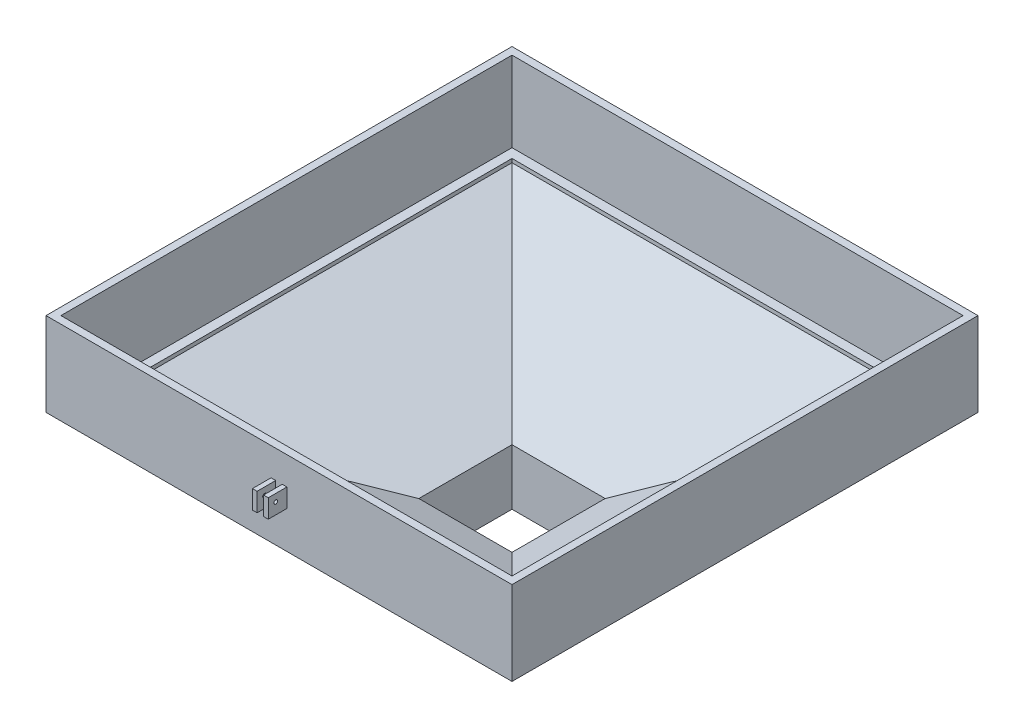
from build123d import *

# Parameters (mm, degrees)
CROQUIS2_W               = 240
CROQUIS2_H               = 240
CROQUIS2_W_2             = 232
CROQUIS2_H_2             = 232
SALIENTE_EXTRUIR1_DEPTH  = 45
CROQUIS4_W               = 8.5
CROQUIS4_H               = 10
SALIENTE_EXTRUIR2_DEPTH  = 15
CORTAR_EXTRUIR1_REACH    = 187.373
CROQUIS5_R               = 1
CORTAR_EXTRUIR2_REACH    = 187.876
CROQUIS6_W               = 3.5
CROQUIS6_H               = 10
SALIENTE_EXTRUIR3_DEPTH  = 240
CORTAR_EXTRUIR3_DEPTH    = 250
SALIENTE_EXTRUIR4_DEPTH  = 240
CORTAR_EXTRUIR4_DEPTH    = 250
CROQUIS11_W              = 54
CROQUIS11_H              = 54
CROQUIS11_W_2            = 50
CROQUIS11_H_2            = 50
SALIENTE_EXTRUIR5_DEPTH  = 30
CORTAR_EXTRUIR5_START    = -54
CORTAR_EXTRUIR5_DEPTH    = 54
CROQUIS14_W              = 240
CROQUIS14_H              = 45
SALIENTE_EXTRUIR6_DEPTH  = 5
CROQUIS15_W              = 245
CROQUIS15_H              = 45
SALIENTE_EXTRUIR7_DEPTH  = 5
CROQUIS16_W              = 245
CROQUIS16_H              = 45
SALIENTE_EXTRUIR8_DEPTH  = 5
CROQUIS17_W              = 250
CROQUIS17_H              = 45
SALIENTE_EXTRUIR9_DEPTH  = 5
CROQUIS18_W              = 242
CROQUIS18_H              = 242
CORTAR_EXTRUIR6_DEPTH    = 43
SALIENTE_EXTRUIR10_DEPTH = 28
CORTAR_EXTRUIR7_REACH    = 213.906
CROQUIS20_R              = 3.9


# Read off the part's stored shape, not the designer's step: Cortar-Extruir5
with BuildPart() as part:
    # Croquis2 → Saliente-Extruir1 (new body)
    with BuildSketch(Plane(origin=(0, 0, 0), x_dir=(1, 0, 0), z_dir=(0, 1, 0))):
        with Locations((5, 5)):
            Rectangle(CROQUIS2_W, CROQUIS2_H)
        with Locations((5, 5)):
            Rectangle(CROQUIS2_W_2, CROQUIS2_H_2, mode=Mode.SUBTRACT)
    extrude(amount=SALIENTE_EXTRUIR1_DEPTH)

    # Croquis4 → Saliente-Extruir2 (add)
    with BuildSketch(Plane.XY.offset(115)):
        with Locations((5, 25)):
            Rectangle(CROQUIS4_W, CROQUIS4_H)
    extrude(amount=SALIENTE_EXTRUIR2_DEPTH)

    # Croquis5 → Cortar-Extruir1 (cut, up to next)
    with BuildSketch(Plane(origin=(9.25, 0, 0), x_dir=(0, 0, -1), z_dir=(1, 0, 0)), mode=Mode.PRIVATE) as cortar_extruir1_sk1:
        with Locations(Location((-126, 26, 0), (0, 0, 90))):
            Circle(CROQUIS5_R)
    cortar_extruir1_tool1 = extrude(cortar_extruir1_sk1.sketch, amount=-CORTAR_EXTRUIR1_REACH, mode=Mode.PRIVATE) & part.part
    add(cortar_extruir1_tool1.solids().sort_by_distance((9.25, 26, 126))[0], mode=Mode.SUBTRACT)

    # Croquis6 → Cortar-Extruir2 (cut, up to next)
    with BuildSketch(Plane(origin=(0, 45, 0), x_dir=(1, 0, 0), z_dir=(0, 1, 0)), mode=Mode.PRIVATE) as cortar_extruir2_sk1:
        with Locations((5, -125)):
            Rectangle(CROQUIS6_W, CROQUIS6_H)
    cortar_extruir2_tool1 = extrude(cortar_extruir2_sk1.sketch, amount=-CORTAR_EXTRUIR2_REACH, mode=Mode.PRIVATE) & part.part
    add(cortar_extruir2_tool1.solids().sort_by_distance((5, 45, 125))[0], mode=Mode.SUBTRACT)

    # Croquis7 → Saliente-Extruir3 (add)
    with BuildSketch(Plane.ZY.offset(115)):
        Polygon((113, 0), (115, 0), (22, -40), (20, -40), align=None)
        Polygon((-125, 0), (-123, 0), (-30, -40), (-32, -40), align=None)
    extrude(amount=-SALIENTE_EXTRUIR3_DEPTH)

    # Croquis8 → Cortar-Extruir3 (cut)
    with BuildSketch(Plane.XY.offset(115)):
        Polygon((123, 0), (30, -40), (125, -40), (125, 0), align=None)
        Polygon((-115, -40), (-20, -40), (-113, 0), (-115, 0), align=None)
    extrude(amount=-CORTAR_EXTRUIR3_DEPTH, mode=Mode.SUBTRACT)

    # Croquis9 → Saliente-Extruir4 (add)
    with BuildSketch(Plane(origin=(0, 0, -125), x_dir=(-1, 0, 0), z_dir=(0, 0, -1))):
        Polygon((20, -40), (22, -40), (115, 0), (113, 0), align=None)
        Polygon((-30, -40), (-32, -40), (-125, 0), (-123, 0), align=None)
    extrude(amount=-SALIENTE_EXTRUIR4_DEPTH)

    # Croquis10 → Cortar-Extruir4 (cut)
    with BuildSketch(Plane.ZY.offset(115)):
        Polygon((-125, -40), (-125, 0), (-32, -40), align=None)
        Polygon((22, -40), (115, -40), (115, 0), align=None)
    extrude(amount=-CORTAR_EXTRUIR4_DEPTH, mode=Mode.SUBTRACT)

    # Croquis11 → Saliente-Extruir5 (add)
    with BuildSketch(Plane.XZ.offset(40)):
        with Locations((5, -5)):
            Rectangle(CROQUIS11_W, CROQUIS11_H)
        with Locations((5, -5)):
            Rectangle(CROQUIS11_W_2, CROQUIS11_H_2, mode=Mode.SUBTRACT)
    extrude(amount=SALIENTE_EXTRUIR5_DEPTH)

    # Cortar-Extruir5 outline → Cortar-Extruir5 (cut)
    with BuildSketch(Plane(origin=(32, 0, 0), x_dir=(0, 0, -1), z_dir=(1, 0, 0)).offset(CORTAR_EXTRUIR5_START)):
        Polygon((-22, -70), (32, -70), (-22, -69.999), align=None)
    extrude(amount=CORTAR_EXTRUIR5_DEPTH, mode=Mode.SUBTRACT)

    # Croquis14 → Saliente-Extruir6 (add)
    with BuildSketch(Plane.XY.offset(115)):
        with Locations((5, 22.5)):
            Rectangle(CROQUIS14_W, CROQUIS14_H)
    extrude(amount=SALIENTE_EXTRUIR6_DEPTH)

    # Croquis15 → Saliente-Extruir7 (add)
    with BuildSketch(Plane(origin=(125, 0, 0), x_dir=(0, 0, -1), z_dir=(1, 0, 0))):
        with Locations((2.5, 22.5)):
            Rectangle(CROQUIS15_W, CROQUIS15_H)
    extrude(amount=SALIENTE_EXTRUIR7_DEPTH)

    # Croquis16 → Saliente-Extruir8 (add)
    with BuildSketch(Plane(origin=(0, 0, -125), x_dir=(-1, 0, 0), z_dir=(0, 0, -1))):
        with Locations((-7.5, 22.5)):
            Rectangle(CROQUIS16_W, CROQUIS16_H)
    extrude(amount=SALIENTE_EXTRUIR8_DEPTH)

    # Croquis17 → Saliente-Extruir9 (add)
    with BuildSketch(Plane.ZY.offset(115)):
        with Locations((-5, 22.5)):
            Rectangle(CROQUIS17_W, CROQUIS17_H)
    extrude(amount=SALIENTE_EXTRUIR9_DEPTH)

    # Croquis18 → Cortar-Extruir6 (cut)
    with BuildSketch(Plane(origin=(0, 45, 0), x_dir=(1, 0, 0), z_dir=(0, 1, 0))):
        with Locations((5, 5)):
            Rectangle(CROQUIS18_W, CROQUIS18_H)
    extrude(amount=-CORTAR_EXTRUIR6_DEPTH, mode=Mode.SUBTRACT)

    # Croquis19 → Saliente-Extruir10 (add)
    with BuildSketch(Plane(origin=(32, 0, 0), x_dir=(0, 0, -1), z_dir=(1, 0, 0))):
        Polygon((32, -70), (32, -68), (-9.324230876, -68), (-9.324230876, -69.999234736), align=None)
    extrude(amount=SALIENTE_EXTRUIR10_DEPTH)

    # Croquis20 → Cortar-Extruir7 (cut, up to next)
    with BuildSketch(Plane(origin=(32, 0, 0), x_dir=(0, 0, -1), z_dir=(1, 0, 0)), mode=Mode.PRIVATE) as cortar_extruir7_sk1:
        with Locations((26.058589575, -62)):
            Circle(CROQUIS20_R)
    cortar_extruir7_tool1 = extrude(cortar_extruir7_sk1.sketch, amount=-CORTAR_EXTRUIR7_REACH, mode=Mode.PRIVATE) & part.part
    add(cortar_extruir7_tool1.solids().sort_by_distance((32, -62, -26.05859))[0], mode=Mode.SUBTRACT)


solid = part.part
